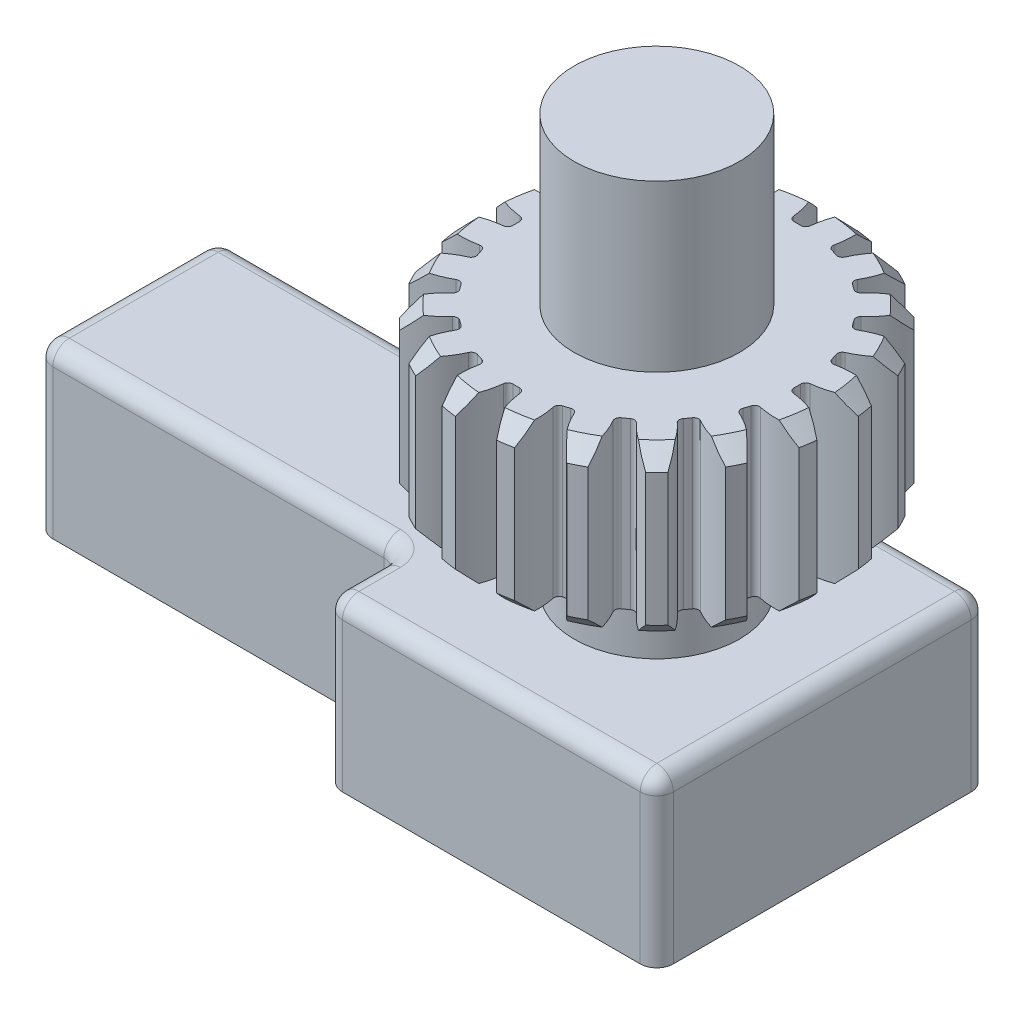
from build123d import *

# Parameters (mm, degrees)
SKETCH1_R                = 11
BOSS_EXTRUDE1_DEPTH      = 5
CUT_EXTRUDE4_DEPTH       = 17.340134638
FILLET1_R                = 0.3
CHAMFER1_SIZE            = 1
CIRPATTERN1_COUNT        = 20
FILLET1_OF_CIRPATTERN1_R = 0.3
SKETCH3_R                = 5
BOSS_EXTRUDE2_DEPTH      = 10
BOSS_EXTRUDE3_START      = 5
SKETCH6_R                = 5
BOSS_EXTRUDE3_DEPTH      = 5
BOSS_EXTRUDE5_DEPTH      = 10
CUT_EXTRUDE5_DEPTH       = 6
FILLET2_R                = 1


with BuildPart() as part:
    # Sketch1 → Boss-Extrude1 (new, symmetric)
    with BuildSketch(Plane(origin=(0, 0, 0), x_dir=(1, 0, 0), z_dir=(0, 1, 0))):
        Circle(SKETCH1_R)
    extrude(amount=BOSS_EXTRUDE1_DEPTH, both=True)

    # Sketch2 → Cut-Extrude4 (cut, symmetric)
    with BuildSketch(Plane(origin=(0, 0, 0), x_dir=(1, 0, 0), z_dir=(0, 1, 0))):
        with BuildLine():
            ThreePointArc((-1.250422517, 10.928698163), (-0.712144791, 9.755836403), (-0.479751903, 8.486450266))
            ThreePointArc((-0.479751903, 8.486450266), (0, 8.5), (0.479751903, 8.486450266))
            ThreePointArc((0.479751903, 8.486450266), (0.712144791, 9.755836403), (1.250422517, 10.928698163))
            ThreePointArc((1.250422517, 10.928698163), (0, 11), (-1.250422517, 10.928698163))
        make_face()
    cut_extrude4 = extrude(amount=CUT_EXTRUDE4_DEPTH, both=True, mode=Mode.SUBTRACT)

    # Fillet1
    fillet1_edges = [part.edges().sort_by_distance(p)[0] for p in [
        (0.479751903, 0, -8.486450266),
        (-0.479751903, 0, -8.486450266),
    ]]
    fillet(fillet1_edges, radius=FILLET1_R)

    # Chamfer1
    chamfer1_edges = [part.edges().sort_by_distance(p)[0] for p in [
        (0, 5, 11),
        (0, -5, 11),
    ]]
    chamfer(chamfer1_edges, length=CHAMFER1_SIZE)

    # CirPattern1: Cut-Extrude4 ×20 about axis
    cirpattern1_axis = Axis((0, 5, 0), (0, -1, 0))
    for i in range(1, CIRPATTERN1_COUNT):
        add(cut_extrude4.rotate(cirpattern1_axis, i * 360 / CIRPATTERN1_COUNT), mode=Mode.SUBTRACT)

    # Fillet1 of CirPattern1
    fillet1_of_cirpattern1_edges = [part.edges().sort_by_distance(p)[0] for p in [
        (3.078728528, 0, -7.922842334),
        (2.16618618, 0, -8.219345317),
        (5.376337753, 0, -6.583691393),
        (4.600082868, 0, -7.14767358),
        (7.14767358, 0, -4.600082868),
        (6.583691393, 0, -5.376337753),
        (8.219345317, 0, -2.16618618),
        (7.922842334, 0, -3.078728528),
        (8.486450266, 0, 0.479751903),
        (8.486450266, 0, -0.479751903),
        (7.922842334, 0, 3.078728528),
        (8.219345317, 0, 2.16618618),
        (6.583691393, 0, 5.376337753),
        (7.14767358, 0, 4.600082868),
        (4.600082868, 0, 7.14767358),
        (5.376337753, 0, 6.583691393),
        (2.16618618, 0, 8.219345317),
        (3.078728528, 0, 7.922842334),
        (-0.479751903, 0, 8.486450266),
        (0.479751903, 0, 8.486450266),
        (-3.078728528, 0, 7.922842334),
        (-2.16618618, 0, 8.219345317),
        (-5.376337753, 0, 6.583691393),
        (-4.600082868, 0, 7.14767358),
        (-7.14767358, 0, 4.600082868),
        (-6.583691393, 0, 5.376337753),
        (-8.219345317, 0, 2.16618618),
        (-7.922842334, 0, 3.078728528),
        (-8.486450266, 0, -0.479751903),
        (-8.486450266, 0, 0.479751903),
        (-7.922842334, 0, -3.078728528),
        (-8.219345317, 0, -2.16618618),
        (-6.583691393, 0, -5.376337753),
        (-7.14767358, 0, -4.600082868),
        (-4.600082868, 0, -7.14767358),
        (-5.376337753, 0, -6.583691393),
        (-2.16618618, 0, -8.219345317),
        (-3.078728528, 0, -7.922842334),
    ]]
    fillet(fillet1_of_cirpattern1_edges, radius=FILLET1_OF_CIRPATTERN1_R)

    # Sketch3 → Boss-Extrude2 (add)
    with BuildSketch(Plane(origin=(0, 5, 0), x_dir=(1, 0, 0), z_dir=(0, 1, 0))):
        Circle(SKETCH3_R)
    extrude(amount=BOSS_EXTRUDE2_DEPTH)

    # Sketch6 → Boss-Extrude3 (add)
    with BuildSketch(Plane.XZ.offset(5).offset(BOSS_EXTRUDE3_START)):
        Circle(SKETCH6_R)
    extrude(amount=-BOSS_EXTRUDE3_DEPTH)

    # Sketch11 → Boss-Extrude5 (add)
    with BuildSketch(Plane.XZ.offset(10)):
        Polygon((10, 10), (-10, 10), (-10, 5.5), (-32, 5.5), (-32, -5.5), (-10, -5.5), (-10, -10), (10, -10), align=None)
    extrude(amount=BOSS_EXTRUDE5_DEPTH)

    # Sketch12 → Cut-Extrude5 (cut)
    with BuildSketch(Plane.XZ.offset(20)):
        Polygon((8.5, 8.5), (-8.5, 8.5), (-8.5, 4), (-29.5, 4), (-29.5, -4), (-8.5, -4), (-8.5, -8.5), (8.5, -8.5), align=None)
    extrude(amount=-CUT_EXTRUDE5_DEPTH, mode=Mode.SUBTRACT)

    # Fillet2
    fillet2_edges = [part.edges().sort_by_distance(p)[0] for p in [
        (-10, -10, 7.75),
        (-10, -10, -7.75),
        (10, -10, 0),
        (0, -10, 10),
        (-21, -10, 5.5),
        (-32, -10, 0),
        (-21, -10, -5.5),
        (0, -10, -10),
        (10, -15, 10),
        (-10, -15, 10),
        (-10, -15, -5.5),
        (-10, -15, 5.5),
        (-32, -15, 5.5),
        (-32, -15, -5.5),
        (-10, -15, -10),
        (10, -15, -10),
        (-8.5, -17, -8.5),
        (-8.5, -17, -4),
        (8.5, -17, -8.5),
        (8.5, -17, 8.5),
        (-8.5, -17, 8.5),
        (-8.5, -17, 4),
        (-29.5, -17, -4),
        (-29.5, -17, 4),
    ]]
    fillet(fillet2_edges, radius=FILLET2_R)


solid = part.part
